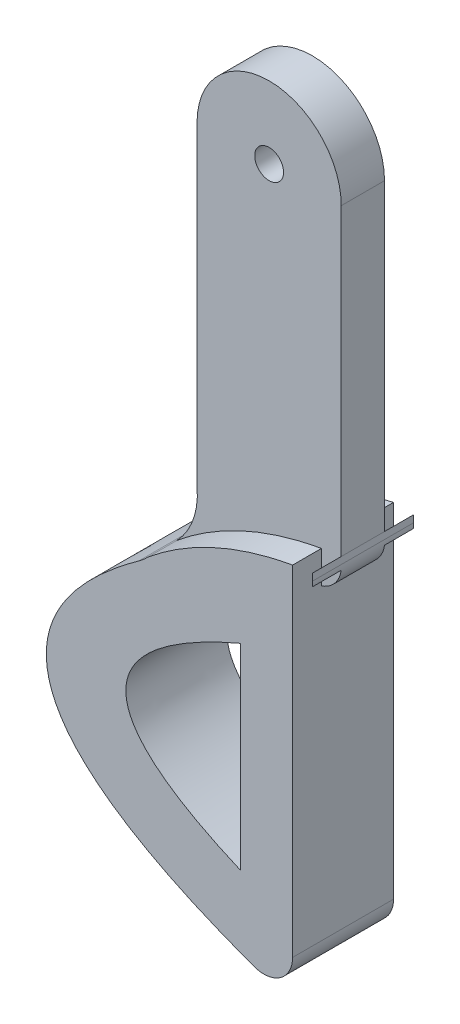
from build123d import *

# Parameters (mm, degrees)
SKETCH_1_R           = 1
EXTRUDE_1_DEPTH      = 3
EXTRUDE_2_DEPTH      = 2
EXTRUDE_2_DEPTH_BACK = 5
FILLET_START         = -3
FILLET_3_DEPTH       = 9
FILLET_4_R           = 5
CUT_EXTRUDE_2_DEPTH  = 2
CUT_EXTRUDE_3_DEPTH  = 2


with BuildPart() as part:
    # 草图1 → 凸台-拉伸1 (new body)
    with BuildSketch(Plane.XY):
        with BuildLine():
            Line((-5, 0), (-5, -18.11131196))
            Line((-5, -18.11131196), (5, -18.11131196))
            Line((5, -18.11131196), (5, 0))
            ThreePointArc((5, 0), (0, 5), (-5, 0))
        make_face()
        Circle(SKETCH_1_R, mode=Mode.SUBTRACT)
    extrude(amount=EXTRUDE_1_DEPTH)

    # 草图2 → 凸台-拉伸2 (add, two sides: drawn at the far end of the back side and taken through both)
    with BuildSketch(Plane.XY.offset(3).offset(-EXTRUDE_2_DEPTH_BACK)):
        with BuildLine():
            Line((5, -21.0685844), (5, -18.11131196))
            Line((5, -18.11131196), (-5, -18.11131196))
            Line((-5, -18.11131196), (-5, -21.0685844))
            Line((-5, -21.0685844), (-5, -23.814982117))
            Line((-5, -23.814982117), (-2.964275547, -23.744594918))
            add(Edge.make_bspline(
                [(3.626985758, -47.647589684), (-16.682654634, -40.9110727), (-18.879741736, -32.943407778), (-2.964275547, -23.744594918)],
                knots=[0, 0, 0, 0, 0.912623114, 0.912623114, 0.912623114, 0.912623114], degree=3))
            Line((3.626985758, -47.647589684), (3.626985758, -23.516695498))
            Line((3.626985758, -23.516695498), (5.09467917, -23.465948537))
            Line((5.09467917, -23.465948537), (5, -21.0685844))
        make_face()
        with BuildLine():
            add(Edge.make_bspline(
                [(0, -41.401376639), (-15.873118036, -34.591902926), (0, -27.782429212)],
                knots=[0, 0, 0, 1, 1, 1], degree=2))
            Line((0, -27.782429212), (0, -41.401376639))
        make_face(mode=Mode.SUBTRACT)
    extrude(amount=EXTRUDE_2_DEPTH + EXTRUDE_2_DEPTH_BACK)

    # 圆角3: read off the stored shape, not the designer's step
    # 圆角3 outline → 圆角3 (cut)
    with BuildSketch(Plane.XY.offset(FILLET_START)):
        with BuildLine():
            Line((5.09467917, -23.465948537), (5.018307469, -21.532146448))
            ThreePointArc((5.018307469, -21.532146448), (4.657500154, -22.759179091), (3.626985758, -23.516695498))
            Line((3.626985758, -23.516695498), (5.09467917, -23.465948537))
        make_face()
        with BuildLine():
            Line((-5, -23.814982117), (-2.964275547, -23.744594918))
            ThreePointArc((-2.964275547, -23.744594918), (-4.401526149, -23.171702163), (-5, -21.744914003))
            Line((-5, -21.744914003), (-5, -23.814982117))
        make_face()
        with BuildLine():
            Line((3.626985758, -47.647589684), (3.626985758, -44.832103607))
            ThreePointArc((3.626985758, -44.832103607), (2.771627596, -46.472163076), (0.937190695, -46.709384292))
            add(Edge.make_bspline(
                [(3.626985758, -47.647589684), (2.692000341, -47.337463802), (1.795401987, -47.024728671), (0.937190695, -46.709384292)],
                knots=[0, 0, 0, 0, 0.042014004, 0.042014004, 0.042014004, 0.042014004], degree=3))
        make_face()
    extrude(amount=FILLET_3_DEPTH, mode=Mode.SUBTRACT)

    # 圆角4
    fillet_4_edges = [part.edges().sort_by_distance(p)[0] for p in [
        (-2.964275547, -23.744594918, 0.5),
    ]]
    fillet(fillet_4_edges, radius=FILLET_4_R)

    # 草图6 → 切除-拉伸2 (cut)
    with BuildSketch(Plane.XY.offset(5)):
        with BuildLine():
            Line((3.626985758, -21.269208488), (3.626985758, -25.801560292))
            Line((3.626985758, -25.801560292), (5, -25.801560292))
            Line((5, -25.801560292), (5, -18.11131196))
            Line((5, -18.11131196), (-5, -18.11131196))
            Line((-5, -18.11131196), (-5, -21.269208488))
            Line((-5, -21.269208488), (-7.053376084, -26.364298767))
            add(Edge.make_bspline(
                [(3.626985758, -21.269208488), (-2.623871875, -22.388888024), (-7.053376084, -26.364298767)],
                knots=[0, 0, 0, 1, 1, 1], degree=2))
        make_face()
    extrude(amount=-CUT_EXTRUDE_2_DEPTH, mode=Mode.SUBTRACT)

    # 草图7 → 切除-拉伸3 (cut)
    with BuildSketch(Plane(origin=(0, 0, -2), x_dir=(-1, 0, 0), z_dir=(0, 0, -1))):
        with BuildLine():
            Line((-3.626985758, -21.004340975), (-3.626985758, -25.801560292))
            Line((-3.626985758, -25.801560292), (-5, -25.801560292))
            Line((-5, -25.801560292), (-5, -18.11131196))
            Line((-5, -18.11131196), (7.053376084, -18.11131196))
            Line((7.053376084, -18.11131196), (7.053376084, -26.364298767))
            add(Edge.make_bspline(
                [(-3.626985758, -21.004340975), (2.577596391, -22.360926345), (7.053376084, -26.364298767)],
                knots=[0, 0, 0, 1, 1, 1], degree=2))
        make_face()
    extrude(amount=-CUT_EXTRUDE_3_DEPTH, mode=Mode.SUBTRACT)


solid = part.part
